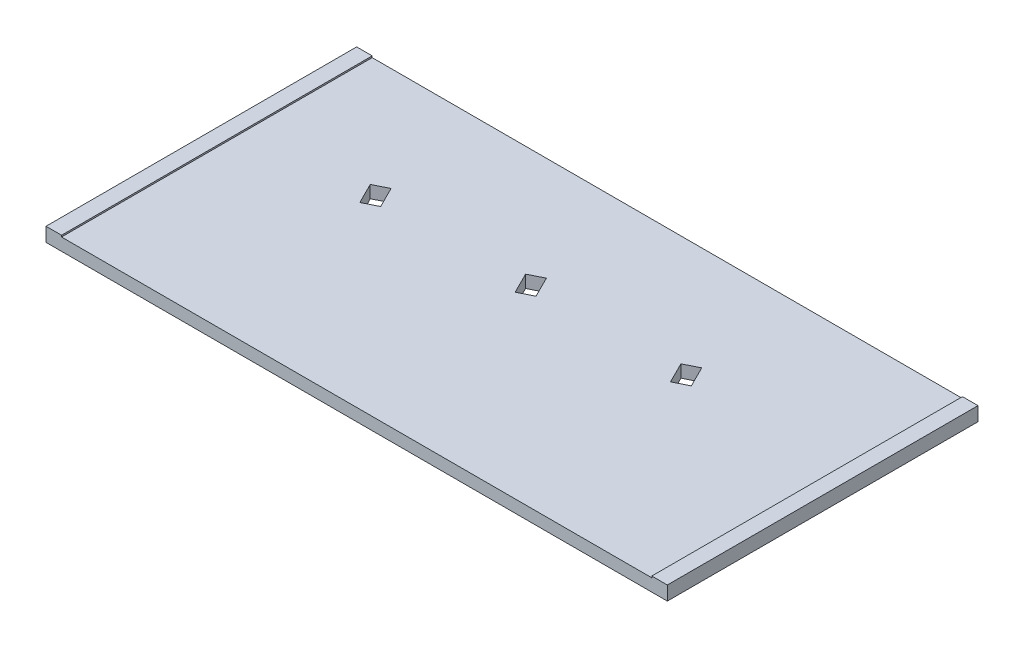
from build123d import *

# Parameters (mm, degrees)
SKETCH1_W            = 101.6
SKETCH1_H            = 50.8
BOSS_EXTRUDE1_DEPTH  = 2.032
CUT_EXTRUDE1_DEPTH   = 57.832464525
LPATTERN1_COUNT      = 2
LPATTERN1_PITCH      = 25.4
LPATTERN1_COUNT_DIR2 = 2
LPATTERN1_PITCH_DIR2 = 25.4
SKETCH4_W            = 2.54
SKETCH4_H            = 50.8
BOSS_EXTRUDE2_DEPTH  = 0.254


with BuildPart() as part:
    # Sketch1 → Boss-Extrude1 (new body)
    with BuildSketch(Plane(origin=(0, 0, 0), x_dir=(1, 0, 0), z_dir=(0, 1, 0))):
        Rectangle(SKETCH1_W, SKETCH1_H)
    extrude(amount=BOSS_EXTRUDE1_DEPTH)

    # Sketch2 → Cut-Extrude1 (cut, through all)
    with BuildSketch(Plane(origin=(0, 2.032, 0), x_dir=(1, 0, 0), z_dir=(0, 1, 0))):
        Polygon((-5.061841618, 7.282181714), (-3.357663485, 3.874561299), (-1.085916542, 5.010680054), (-2.790094674, 8.418300469), align=None)
    cut_extrude1 = extrude(amount=-CUT_EXTRUDE1_DEPTH, mode=Mode.SUBTRACT)

    # LPattern1: Cut-Extrude1 2 × 2
    with Locations(*[Vector(-1, 0, 0) * (i * LPATTERN1_PITCH) + Vector(1, 0, 0) * (j * LPATTERN1_PITCH_DIR2) for i in range(LPATTERN1_COUNT) for j in range(LPATTERN1_COUNT_DIR2) if (i, j) != (0, 0)]):
        add(cut_extrude1, mode=Mode.SUBTRACT)

    # Sketch4 → Boss-Extrude2 (add)
    with BuildSketch(Plane(origin=(0, 2.032, 0), x_dir=(1, 0, 0), z_dir=(0, 1, 0))):
        with Locations((-49.53, 0)):
            Rectangle(SKETCH4_W, SKETCH4_H)
        with Locations((49.53, 0)):
            Rectangle(SKETCH4_W, SKETCH4_H)
    extrude(amount=BOSS_EXTRUDE2_DEPTH)


solid = part.part
